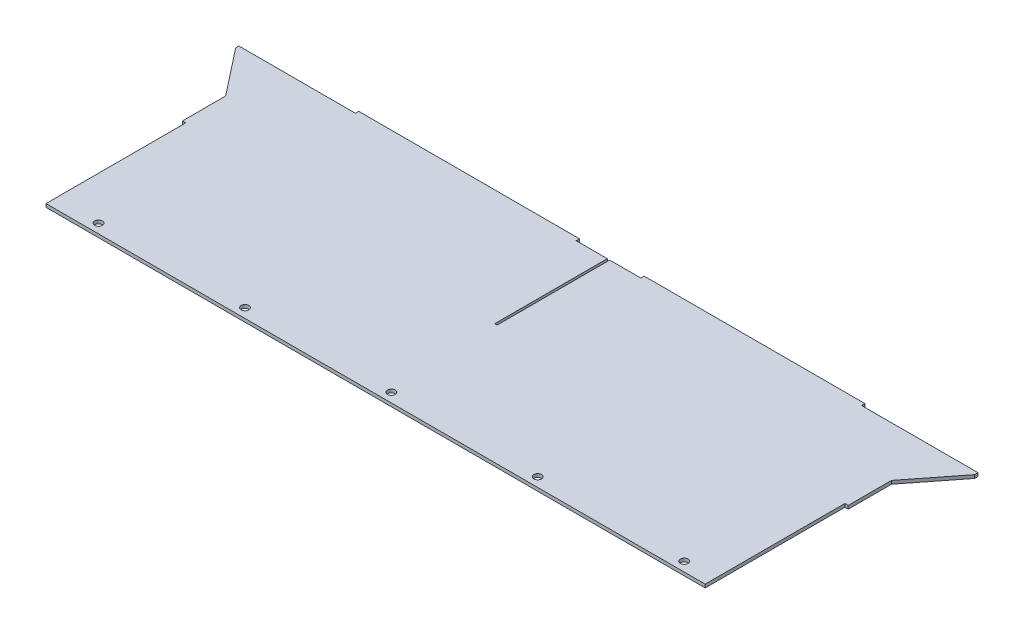
from build123d import *

# Parameters (mm, degrees)
SKETCH1_W           = 635.3556
SKETCH1_H           = 222.25
BOSS_EXTRUDE1_DEPTH = 1.5875
SKETCH2_W           = 210.6549
SKETCH2_H           = 3.175
BOSS_EXTRUDE2_DEPTH = 3.175
BOSS_EXTRUDE3_DEPTH = 3.175
SKETCH4_R           = 3.675
CUT_EXTRUDE1_DEPTH  = 10
LPATTERN1_COUNT     = 5
LPATTERN1_PITCH     = 139.7
SKETCH6_W           = 3.175
SKETCH6_H           = 133.35
SKETCH6_W_2         = 2.286
SKETCH6_H_2         = 107.442
CUT_EXTRUDE2_DEPTH  = 371.679518173


with BuildPart() as part:
    # Sketch1 → Boss-Extrude1 (new, symmetric)
    with BuildSketch(Plane(origin=(0, 0, 0), x_dir=(1, 0, 0), z_dir=(0, 1, 0))):
        Rectangle(SKETCH1_W, SKETCH1_H)
    extrude(amount=BOSS_EXTRUDE1_DEPTH, both=True)

    # Sketch2 → Boss-Extrude2 (add)
    with BuildSketch(Plane(origin=(0, 0, -111.125), x_dir=(-1, 0, 0), z_dir=(0, 0, -1))):
        with Locations((136.15035, 0)):
            Rectangle(SKETCH2_W, SKETCH2_H)
        with Locations((-136.15035, 0)):
            Rectangle(SKETCH2_W, SKETCH2_H)
    extrude(amount=BOSS_EXTRUDE2_DEPTH)

    # Sketch3 → Boss-Extrude3 (add)
    with BuildSketch(Plane(origin=(0, 1.5875, 0), x_dir=(1, 0, 0), z_dir=(0, 1, 0))):
        Polygon((-317.6778, 63.5), (-317.6778, 111.125), (-352.6028, 111.125), (-352.6028, 107.95), align=None)
    boss_extrude3 = extrude(amount=-BOSS_EXTRUDE3_DEPTH)

    # Mirror1: Boss-Extrude3 across plane
    add(boss_extrude3.mirror(Plane(origin=(0, 0, 0), x_dir=(0, 0, 1), z_dir=(1, 0, 0))))

    # Sketch4 → Cut-Extrude1 (cut)
    with BuildSketch(Plane(origin=(0, 1.5875, 0), x_dir=(1, 0, 0), z_dir=(0, 1, 0))):
        with Locations((-273.2278, -102.235)):
            Circle(SKETCH4_R)
    cut_extrude1 = extrude(amount=-CUT_EXTRUDE1_DEPTH, mode=Mode.SUBTRACT)

    # LPattern1: Cut-Extrude1 ×5
    with Locations(*[(i * LPATTERN1_PITCH, 0, 0) for i in range(1, LPATTERN1_COUNT)]):
        add(cut_extrude1, mode=Mode.SUBTRACT)

    # Sketch6 → Cut-Extrude2 (cut, through all)
    with BuildSketch(Plane(origin=(0, 1.5875, 0), x_dir=(1, 0, 0), z_dir=(0, 1, 0))):
        with Locations((316.0903, -44.45)):
            Rectangle(SKETCH6_W, SKETCH6_H)
        with Locations((-316.0903, -44.45)):
            Rectangle(SKETCH6_W, SKETCH6_H)
        with Locations((0, 57.404)):
            Rectangle(SKETCH6_W_2, SKETCH6_H_2)
    extrude(amount=-CUT_EXTRUDE2_DEPTH, mode=Mode.SUBTRACT)


solid = part.part
